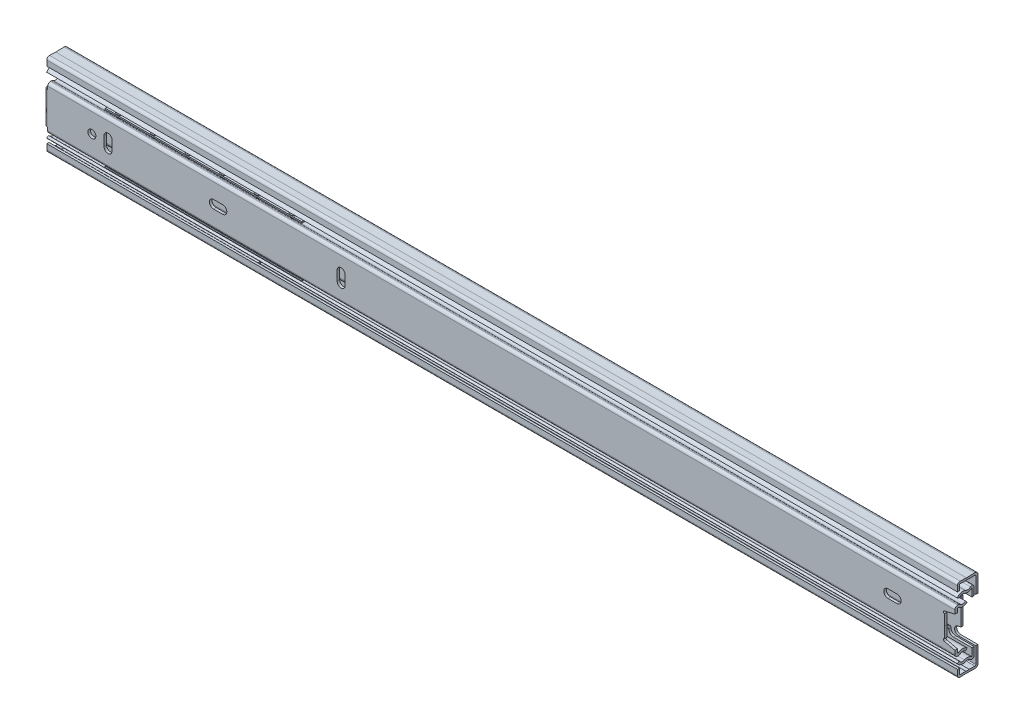
from build123d import *
from build123d.topology import SkipClean

# Parameters (mm, degrees)
EXTRUDE1_DEPTH      = 250.063
MIDDLE_MEMBER_DEPTH = 500.126
DRAWER_START        = -500.126
DRAWER_MEMBER_DEPTH = 500.126
SKETCH6_W           = 1.905
SKETCH6_H           = 12.147486483
CUT_EXTRUDE1_DEPTH  = 252.423154878
EXTRUDE4_DEPTH      = 8.89
CUT_EXTRUDE2_DEPTH  = 1.1938
CUT_EXTRUDE3_DEPTH  = 1.397
CUT_EXTRUDE4_DEPTH  = 252.196524666
CUT_EXTRUDE5_DEPTH  = 1.1938
CUT_EXTRUDE14_DEPTH = 1.1938
CUT_EXTRUDE6_DEPTH  = 1.1938
CUT_E_DEPTH         = 1.1938
SKETCH24_R          = 2.1844
CUT_EXTRUDE13_DEPTH = 1.397
CUT_D_DEPTH         = 1.397
LPATTERN1_COUNT     = 6
LPATTERN1_PITCH     = 19.05
EXTRUDE7_DEPTH      = 6.35
EXTRUDE7_DEPTH_BACK = 101.6
SKETCH28_W          = 7.62
SKETCH28_H          = 0.762
LPATTERN2_COUNT     = 6
LPATTERN2_PITCH     = 19.05
EXTRUDE8_DEPTH      = 6.35
EXTRUDE8_DEPTH_BACK = 101.6
SKETCH30_W          = 5.08
SKETCH30_H          = 0.762


# Read off the part's stored shape, not the designer's step: Drawer Member
with BuildPart() as part:
    # Sketch1 → Extrude1 (new, symmetric)
    with BuildSketch(Plane(origin=(0, 0, 0), x_dir=(0, 0, -1), z_dir=(1, 0, 0))):
        with BuildLine():
            Line((-4.139279899, 22.8203125), (-0.743323143, 22.698920454))
            Line((-0.743323143, 22.698920454), (3.892452069, 22.8203125))
            ThreePointArc((3.892452069, 22.8203125), (5.124499805, 22.338098312), (5.6388, 21.119095664))
            Line((5.6388, 21.119095664), (5.6388, 0))
            Line((5.6388, 0), (4.445, 0))
            Line((4.445, 0), (4.445, 21.119095664))
            ThreePointArc((4.445, 21.119095664), (4.291477554, 21.482977052), (3.92370211, 21.626921585))
            Line((3.92370211, 21.626921585), (0.761857041, 21.544125758))
            ThreePointArc((0.761857041, 21.544125758), (-0.187154328, 21.71413397), (-1.131158407, 21.51822157))
            Line((-1.131158407, 21.51822157), (-4.181926298, 21.627274477))
            ThreePointArc((-4.181926298, 21.627274477), (-4.367367911, 21.55622161), (-4.445, 21.3734366))
            Line((-4.445, 21.3734366), (-4.445, 18.415))
            Line((-4.445, 18.415), (-5.6388, 18.415))
            Line((-5.6388, 18.415), (-5.6388, 21.3734366))
            ThreePointArc((-5.6388, 21.3734366), (-5.19629709, 22.415311161), (-4.139279899, 22.8203125))
        make_face()
    extrude(amount=EXTRUDE1_DEPTH, both=True)

    # Sketch8 → Cut-Extrude2 (cut)
    with BuildSketch(Plane.XY.offset(-4.445)):
        with BuildLine():
            Line((240.424533997, 7.645578895), (241.8588, 7.493000005))
            Line((241.8588, 7.493000005), (241.8588, 0))
            Line((241.8588, 0), (250.063, 0))
            Line((250.063, 0), (250.063, 12.204752384))
            Line((250.063, 12.204752384), (240.666356843, 12.204752384))
            ThreePointArc((240.666356843, 12.204752384), (238.383565723, 10.03983377), (240.424533997, 7.645578895))
        make_face()
    extrude(amount=-CUT_EXTRUDE2_DEPTH, mode=Mode.SUBTRACT)

    # Sketch13 → Cut-Extrude5 (cut)
    with BuildSketch(Plane.XY.offset(-4.445)):
        with BuildLine():
            Line((-181.674699917, 7.112000069), (-206.503199931, 7.112000069))
            ThreePointArc((-206.503199931, 7.112000069), (-207.042015347, 6.888815416), (-207.2652, 6.35))
            Line((-207.2652, 6.35), (-207.2652, 0))
            Line((-207.2652, 0), (-209.5512, 0))
            Line((-209.5512, 0), (-209.5512, 6.35))
            ThreePointArc((-209.5512, 6.35), (-209.774384653, 6.888815416), (-210.313200069, 7.112000069))
            Line((-210.313200069, 7.112000069), (-232.601699917, 7.112000069))
            ThreePointArc((-232.601699917, 7.112000069), (-234.189199917, 8.699500069), (-232.601699917, 10.287000069))
            Line((-232.601699917, 10.287000069), (-181.674699917, 10.287000069))
            ThreePointArc((-181.674699917, 10.287000069), (-180.087199917, 8.699500069), (-181.674699917, 7.112000069))
        make_face()
        with BuildLine():
            Line((-187.288099917, 2.286), (-192.241099917, 2.286))
            ThreePointArc((-192.241099917, 2.286), (-193.857546018, 1.616446102), (-194.527099917, 0))
            Line((-194.527099917, 0), (-185.002099917, 0))
            ThreePointArc((-185.002099917, 0), (-185.671653815, 1.616446102), (-187.288099917, 2.286))
        make_face()
        with BuildLine():
            Line((-226.340599917, 0), (-221.768599917, 0))
            ThreePointArc((-221.768599917, 0), (-224.054599917, 2.286), (-226.340599917, 0))
        make_face()
        with BuildLine():
            Line((-218.238000083, 0), (-211.887999917, 0))
            ThreePointArc((-211.887999917, 0), (-215.063, 3.175000083), (-218.238000083, 0))
        make_face()
        with BuildLine():
            Line((-204.750599917, 0), (-200.178599917, 0))
            ThreePointArc((-200.178599917, 0), (-202.464599917, 2.286), (-204.750599917, 0))
        make_face()
    extrude(amount=-CUT_EXTRUDE5_DEPTH, mode=Mode.SUBTRACT)

    # Sketch32 → Cut-Extrude14 (cut)
    with BuildSketch(Plane(origin=(0, 0, -5.6388), x_dir=(-1, 0, 0), z_dir=(0, 0, -1))):
        with BuildLine():
            Line((69.6005, 0), (79.1255, 0))
            ThreePointArc((79.1255, 0), (78.455946102, 1.616446102), (76.8395, 2.286))
            Line((76.8395, 2.286), (71.8865, 2.286))
            ThreePointArc((71.8865, 2.286), (70.270053898, 1.616446102), (69.6005, 0))
        make_face()
        with BuildLine():
            Line((83.888, 0), (90.238, 0))
            ThreePointArc((90.238, 0), (87.063, 3.175), (83.888, 0))
        make_face()
        with BuildLine():
            Line((93.7305, 0), (103.2555, 0))
            ThreePointArc((103.2555, 0), (102.585946102, 1.616446102), (100.9695, 2.286))
            Line((100.9695, 2.286), (96.0165, 2.286))
            ThreePointArc((96.0165, 2.286), (94.400053898, 1.616446102), (93.7305, 0))
        make_face()
        with BuildLine():
            Line((106.621, 0), (111.193, 0))
            Line((111.193, 0), (111.193, 8.763000069))
            ThreePointArc((111.193, 8.763000069), (110.746630735, 9.840630803), (109.669, 10.287000069))
            Line((109.669, 10.287000069), (66.4255, 10.287000069))
            ThreePointArc((66.4255, 10.287000069), (64.838, 8.699500069), (66.4255, 7.112000069))
            Line((66.4255, 7.112000069), (105.097, 7.112000069))
            ThreePointArc((105.097, 7.112000069), (106.174630735, 6.665630803), (106.621, 5.588000069))
            Line((106.621, 5.588000069), (106.621, 0))
        make_face()
    extrude(amount=-CUT_EXTRUDE14_DEPTH, mode=Mode.SUBTRACT)

    # Sketch33 → Cut-Extrude6 (cut)
    with BuildSketch(Plane(origin=(83.609365602, 0.812450965, -5.6388), x_dir=(-1, 0, 0), z_dir=(0, 0, -1))):
        with BuildLine():
            Line((57.209865602, -0.812450965), (66.734865602, -0.812450965))
            ThreePointArc((66.734865602, -0.812450965), (66.065311704, 0.803995136), (64.448865602, 1.473549035))
            Line((64.448865602, 1.473549035), (59.495865602, 1.473549035))
            ThreePointArc((59.495865602, 1.473549035), (57.8794195, 0.803995136), (57.209865602, -0.812450965))
        make_face()
        with BuildLine():
            Line((71.497365602, -0.812450965), (77.847365602, -0.812450965))
            ThreePointArc((77.847365602, -0.812450965), (74.672365602, 2.362549035), (71.497365602, -0.812450965))
        make_face()
        with BuildLine():
            Line((81.339865602, -0.812450965), (90.864865602, -0.812450965))
            ThreePointArc((90.864865602, -0.812450965), (90.195311704, 0.803995136), (88.578865602, 1.473549035))
            Line((88.578865602, 1.473549035), (83.625865602, 1.473549035))
            ThreePointArc((83.625865602, 1.473549035), (82.0094195, 0.803995136), (81.339865602, -0.812450965))
        make_face()
        with BuildLine():
            Line((94.230365602, -0.812450965), (98.802365602, -0.812450965))
            Line((98.802365602, -0.812450965), (98.802365602, 7.950549103))
            ThreePointArc((98.802365602, 7.950549103), (98.355996337, 9.028179838), (97.278365602, 9.474549103))
            Line((97.278365602, 9.474549103), (54.034865602, 9.474549103))
            ThreePointArc((54.034865602, 9.474549103), (52.447365602, 7.887049103), (54.034865602, 6.299549103))
            Line((54.034865602, 6.299549103), (92.706365602, 6.299549103))
            ThreePointArc((92.706365602, 6.299549103), (93.783996337, 5.853179838), (94.230365602, 4.775549103))
            Line((94.230365602, 4.775549103), (94.230365602, -0.812450965))
        make_face()
    extrude(amount=-CUT_EXTRUDE6_DEPTH, mode=Mode.SUBTRACT)

    # Sketch34 → Cut E (cut)
    with BuildSketch(Plane(origin=(169.823604257, 1.452669916, -5.6388), x_dir=(-1, 0, 0), z_dir=(0, 0, -1))):
        with BuildLine():
            Line((-16.623895743, -1.452669916), (-7.098895743, -1.452669916))
            ThreePointArc((-7.098895743, -1.452669916), (-7.768449642, 0.163776186), (-9.384895743, 0.833330084))
            Line((-9.384895743, 0.833330084), (-14.337895743, 0.833330084))
            ThreePointArc((-14.337895743, 0.833330084), (-15.954341845, 0.163776186), (-16.623895743, -1.452669916))
        make_face()
        with BuildLine():
            Line((-2.336395743, -1.452669916), (4.013604257, -1.452669916))
            ThreePointArc((4.013604257, -1.452669916), (0.838604257, 1.722330084), (-2.336395743, -1.452669916))
        make_face()
        with BuildLine():
            Line((7.506104257, -1.452669916), (17.031104257, -1.452669916))
            ThreePointArc((17.031104257, -1.452669916), (16.361550358, 0.163776186), (14.745104257, 0.833330084))
            Line((14.745104257, 0.833330084), (9.792104257, 0.833330084))
            ThreePointArc((9.792104257, 0.833330084), (8.175658155, 0.163776186), (7.506104257, -1.452669916))
        make_face()
        with BuildLine():
            Line((20.396604257, -1.452669916), (24.968604257, -1.452669916))
            Line((24.968604257, -1.452669916), (24.968604257, 7.310330153))
            ThreePointArc((24.968604257, 7.310330153), (24.522234991, 8.387960887), (23.444604257, 8.834330153))
            Line((23.444604257, 8.834330153), (-19.798895743, 8.834330153))
            ThreePointArc((-19.798895743, 8.834330153), (-21.386395743, 7.246830153), (-19.798895743, 5.659330153))
            Line((-19.798895743, 5.659330153), (18.872604257, 5.659330153))
            ThreePointArc((18.872604257, 5.659330153), (19.950234991, 5.212960887), (20.396604257, 4.135330153))
            Line((20.396604257, 4.135330153), (20.396604257, -1.452669916))
        make_face()
    extrude(amount=-CUT_E_DEPTH, mode=Mode.SUBTRACT)

    # Mirror3 3: part across plane


with BuildPart() as body_2:
    # Sketch2 → Middle Member (new body)
    with BuildSketch(Plane.ZY.offset(250.063)):
        with BuildLine():
            ThreePointArc((5.7404, 15.627692517), (3.735864231, 17.127444277), (1.241474216, 16.914283663))
            ThreePointArc((1.241474216, 16.914283663), (-0.188944013, 16.688900955), (-1.505642365, 17.291560999))
            ThreePointArc((-1.505642365, 17.291560999), (-2.813430342, 17.487614783), (-3.53059999, 16.376572852))
            Line((-3.53059999, 16.376572852), (-3.53059999, 9.521737984))
            ThreePointArc((-3.53059999, 9.521737984), (-3.220327109, 8.457239952), (-2.386691239, 7.726160915))
            Line((-2.386691239, 7.726160915), (-0.414564934, 6.806543316))
            ThreePointArc((-0.414564934, 6.806543316), (-0.093935732, 6.525359052), (0.0254, 6.115936705))
            Line((0.0254, 6.115936705), (0.0254, 0))
            Line((0.0254, 0), (1.2446, 0))
            Line((1.2446, 0), (1.2446, 6.115936705))
            ThreePointArc((1.2446, 6.115936705), (0.934327119, 7.180434735), (0.100691251, 7.91151377))
            Line((0.100691251, 7.91151377), (-1.871435054, 8.831131369))
            ThreePointArc((-1.871435054, 8.831131369), (-2.192064258, 9.112315634), (-2.31139999, 9.521737984))
            Line((-2.31139999, 9.521737984), (-2.31139999, 16.376572852))
            ThreePointArc((-2.31139999, 16.376572852), (-2.311399987, 16.376572856), (-2.311399982, 16.376572855))
            ThreePointArc((-2.311399982, 16.376572855), (-0.35482671, 15.481038557), (1.770730805, 15.815950333))
            ThreePointArc((1.770730805, 15.815950333), (3.400639083, 15.955235789), (4.710462095, 14.975253591))
            Line((4.710462095, 14.975253591), (5.7404, 15.627692517))
        make_face()
    extrude(amount=-MIDDLE_MEMBER_DEPTH)

    # Sketch12 → Cut-Extrude4 (cut, through all)
    with BuildSketch(Plane.XY.offset(1.2446)):
        with BuildLine():
            Line((250.063, 12.065), (239.903, 12.065))
            ThreePointArc((239.903, 12.065), (238.106948776, 11.321051224), (237.363, 9.525))
            Line((237.363, 9.525), (237.363, 0))
            Line((237.363, 0), (250.063, 0))
            Line((250.063, 0), (250.063, 12.065))
        make_face()
    extrude(amount=-CUT_EXTRUDE4_DEPTH, mode=Mode.SUBTRACT)

    # Mirror3 2: body 2 across plane


with BuildPart() as body_3:
    # Drawer Member outline → Drawer Member (new body)
    with BuildSketch(Plane.ZY.offset(250.063).offset(DRAWER_START)):
        with BuildLine():
            Line((5.6642, 0), (7.0612, 0))
            Line((7.0612, 0), (7.0612, 10.623486483))
            ThreePointArc((7.0612, 10.623486483), (6.614830734, 11.701117218), (5.5372, 12.147486483))
            Line((5.5372, 12.147486483), (5.164341455, 12.147486483))
            ThreePointArc((5.164341455, 12.147486483), (4.67440708, 12.066587417), (4.236487447, 11.83247901))
            ThreePointArc((4.236487447, 11.83247901), (2.709144677, 11.334862777), (1.208194452, 11.907179363))
            Line((1.208194452, 11.907179363), (0.304054167, 10.842219578))
            ThreePointArc((0.304054167, 10.842219578), (2.674694689, 9.938287609), (5.087020295, 10.724235863))
            ThreePointArc((5.087020295, 10.724235863), (5.123513594, 10.743744895), (5.164341455, 10.750486483))
            Line((5.164341455, 10.750486483), (5.5372, 10.750486483))
            ThreePointArc((5.5372, 10.750486483), (5.627002561, 10.713289044), (5.6642, 10.623486483))
            Line((5.6642, 10.623486483), (5.6642, 0))
        make_face()
    extrude(amount=DRAWER_MEMBER_DEPTH)

    # Sketch6 → Cut-Extrude1 (cut, through all)
    with BuildSketch(Plane.XY.offset(7.0612)):
        with Locations((-249.1105, 6.073743242)):
            Rectangle(SKETCH6_W, SKETCH6_H)
    extrude(amount=-CUT_EXTRUDE1_DEPTH, mode=Mode.SUBTRACT)

    # Sketch7 → Extrude4 (add)
    with BuildSketch(Plane.XZ):
        with BuildLine():
            Line((-248.158, 7.0612), (-248.412, 7.0612))
            ThreePointArc((-248.412, 7.0612), (-249.579433296, 6.577633296), (-250.063, 5.4102))
            Line((-250.063, 5.4102), (-250.063, 0.304054167))
            Line((-250.063, 0.304054167), (-248.666, 0.304054167))
            Line((-248.666, 0.304054167), (-248.666, 5.4102))
            ThreePointArc((-248.666, 5.4102), (-248.591605122, 5.589805122), (-248.412, 5.6642))
            Line((-248.412, 5.6642), (-248.158, 5.6642))
            Line((-248.158, 5.6642), (-248.158, 7.0612))
        make_face()
    extrude(amount=-EXTRUDE4_DEPTH)

    # Sketch11 → Cut-Extrude3 (cut)
    with BuildSketch(Plane.XY.offset(7.0612)):
        with BuildLine():
            Line((244.348048602, 5.967847879), (244.348, 0))
            Line((244.348, 0), (250.063, 0))
            Line((250.063, 0), (250.063, 8.589285844))
            Line((250.063, 8.589285844), (244.203673543, 7.221216084))
            ThreePointArc((244.203673543, 7.221216084), (243.717225152, 6.530182899), (244.348048602, 5.967847879))
        make_face()
    extrude(amount=-CUT_EXTRUDE3_DEPTH, mode=Mode.SUBTRACT)

    # Sketch24 → Cut-Extrude13 (cut)
    with BuildSketch(Plane.XY.offset(7.0612)):
        with Locations((-223.901, 0)):
            Circle(SKETCH24_R)
        with BuildLine():
            Line((-217.1954, 2.6416), (-217.1954, 0))
            Line((-217.1954, 0), (-212.8266, 0))
            Line((-212.8266, 0), (-212.8266, 2.6416))
            ThreePointArc((-212.8266, 2.6416), (-215.011, 4.826), (-217.1954, 2.6416))
        make_face()
        with BuildLine():
            Line((-159.3215, 0), (-149.7965, 0))
            ThreePointArc((-149.7965, 0), (-150.466053898, 1.616446102), (-152.0825, 2.286))
            Line((-152.0825, 2.286), (-157.0355, 2.286))
            ThreePointArc((-157.0355, 2.286), (-158.651946102, 1.616446102), (-159.3215, 0))
        make_face()
        with BuildLine():
            Line((-89.1954, 2.6416), (-89.1954, 0))
            Line((-89.1954, 0), (-84.8266, 0))
            Line((-84.8266, 0), (-84.8266, 2.6416))
            ThreePointArc((-84.8266, 2.6416), (-87.011, 4.826), (-89.1954, 2.6416))
        make_face()
    extrude(amount=-CUT_EXTRUDE13_DEPTH, mode=Mode.SUBTRACT)

    # Sketch25 → Cut D (cut)
    with BuildSketch(Plane.XY.offset(7.0612)):
        with BuildLine():
            Line((220.5355, 0), (211.0105, 0))
            ThreePointArc((211.0105, 0), (211.680053898, 1.616446102), (213.2965, 2.286))
            Line((213.2965, 2.286), (218.2495, 2.286))
            ThreePointArc((218.2495, 2.286), (219.865946102, 1.616446102), (220.5355, 0))
        make_face()
    extrude(amount=-CUT_D_DEPTH, mode=Mode.SUBTRACT)

    # Mirror3: body 3 across plane


with BuildPart() as body_4:
    # Sketch27 → Revolve1 (revolve)
    with BuildSketch(Plane.ZY.offset(237.363)):
        with BuildLine():
            Line((0.1524, 21.683172421), (0.1524, 16.665571078))
            ThreePointArc((0.1524, 16.665571078), (2.661200671, 19.174371749), (0.1524, 21.683172421))
        make_face()
    revolve(axis=Axis((-237.363, 23.635004298, 0.1524), (0, -1, 0)))


with BuildPart() as lpattern1_1:
    # LPattern1: pattern copy
    add(body_4.part.moved(Location(Vector(1, 0, 0) * (1 * LPATTERN1_PITCH))))


with BuildPart() as lpattern1_2:
    # LPattern1: pattern copy
    add(body_4.part.moved(Location(Vector(1, 0, 0) * (2 * LPATTERN1_PITCH))))


with BuildPart() as lpattern1_3:
    # LPattern1: pattern copy
    add(body_4.part.moved(Location(Vector(1, 0, 0) * (3 * LPATTERN1_PITCH))))


with BuildPart() as lpattern1_4:
    # LPattern1: pattern copy
    add(body_4.part.moved(Location(Vector(1, 0, 0) * (4 * LPATTERN1_PITCH))))


with BuildPart() as lpattern1_5:
    # LPattern1: pattern copy
    add(body_4.part.moved(Location(Vector(1, 0, 0) * (5 * LPATTERN1_PITCH))))


with BuildPart() as body_4_1:
    add(body_4.part)

    add(lpattern1_1.part)  # Extrude7 merges LPattern1_1

    add(lpattern1_2.part)  # Extrude7 merges LPattern1_2

    add(lpattern1_3.part)  # Extrude7 merges LPattern1_3

    add(lpattern1_4.part)  # Extrude7 merges LPattern1_4

    add(lpattern1_5.part)  # Extrude7 merges LPattern1_5
    # Sketch28 → Extrude7 (add, two sides: drawn at the far end of the back side and taken through both)
    with BuildSketch(Plane.ZY.offset(237.363).offset(-EXTRUDE7_DEPTH_BACK)):
        with Locations((0.1524, 19.174371749)):
            Rectangle(SKETCH28_W, SKETCH28_H)
    extrude(amount=EXTRUDE7_DEPTH + EXTRUDE7_DEPTH_BACK)


with BuildPart() as body_5:
    # Sketch29 → Revolve2 (revolve)
    with BuildSketch(Plane.ZY.offset(211.963)):
        with BuildLine():
            Line((2.7686, 16.043834368), (2.7686, 11.446434358))
            ThreePointArc((2.7686, 11.446434358), (5.067300005, 13.745134363), (2.7686, 16.043834368))
        make_face()
    revolve(axis=Axis((-211.963, 16.680143034, 2.7686), (0, -1, 0)))


with BuildPart() as lpattern2_1:
    # LPattern2: pattern copy
    add(body_5.part.moved(Location(Vector(1, 0, 0) * (1 * LPATTERN2_PITCH))))


with BuildPart() as lpattern2_2:
    # LPattern2: pattern copy
    add(body_5.part.moved(Location(Vector(1, 0, 0) * (2 * LPATTERN2_PITCH))))


with BuildPart() as lpattern2_3:
    # LPattern2: pattern copy
    add(body_5.part.moved(Location(Vector(1, 0, 0) * (3 * LPATTERN2_PITCH))))


with BuildPart() as lpattern2_4:
    # LPattern2: pattern copy
    add(body_5.part.moved(Location(Vector(1, 0, 0) * (4 * LPATTERN2_PITCH))))


with BuildPart() as lpattern2_5:
    # LPattern2: pattern copy
    add(body_5.part.moved(Location(Vector(1, 0, 0) * (5 * LPATTERN2_PITCH))))


with BuildPart() as body_5_1:
    add(body_5.part)

    add(lpattern2_1.part)  # Extrude8 merges LPattern2_1

    add(lpattern2_2.part)  # Extrude8 merges LPattern2_2

    add(lpattern2_3.part)  # Extrude8 merges LPattern2_3

    add(lpattern2_4.part)  # Extrude8 merges LPattern2_4

    add(lpattern2_5.part)  # Extrude8 merges LPattern2_5
    # Sketch30 → Extrude8 (add, two sides: drawn at the far end of the back side and taken through both)
    with BuildSketch(Plane.ZY.offset(211.963).offset(-EXTRUDE8_DEPTH_BACK)):
        with Locations((2.7686, 13.745134363)):
            Rectangle(SKETCH30_W, SKETCH30_H)
    extrude(amount=EXTRUDE8_DEPTH + EXTRUDE8_DEPTH_BACK)


with BuildPart() as body_3_1:
    with SkipClean():  # the faces are left unmerged after this step: merging them gives an invalid solid
        add(body_3.part)
        add(body_3.part.mirror(Plane.ZX))


with BuildPart() as body_2_1:
    add(body_2.part)
    add(body_2.part.mirror(Plane.ZX))


with BuildPart() as part_1:
    with SkipClean():  # the faces are left unmerged after this step: merging them gives an invalid solid
        add(part.part)
        add(part.part.mirror(Plane.ZX))


with BuildPart() as body_6:
    # Mirror5: mirrored copy
    add(body_5_1.part.mirror(Plane.ZX))


with BuildPart() as body_7:
    # Mirror5 2: mirrored copy
    add(body_4_1.part.mirror(Plane.ZX))


solid = Compound([body_4_1.part, body_5_1.part, body_3_1.part, body_2_1.part, part_1.part, body_6.part, body_7.part])
